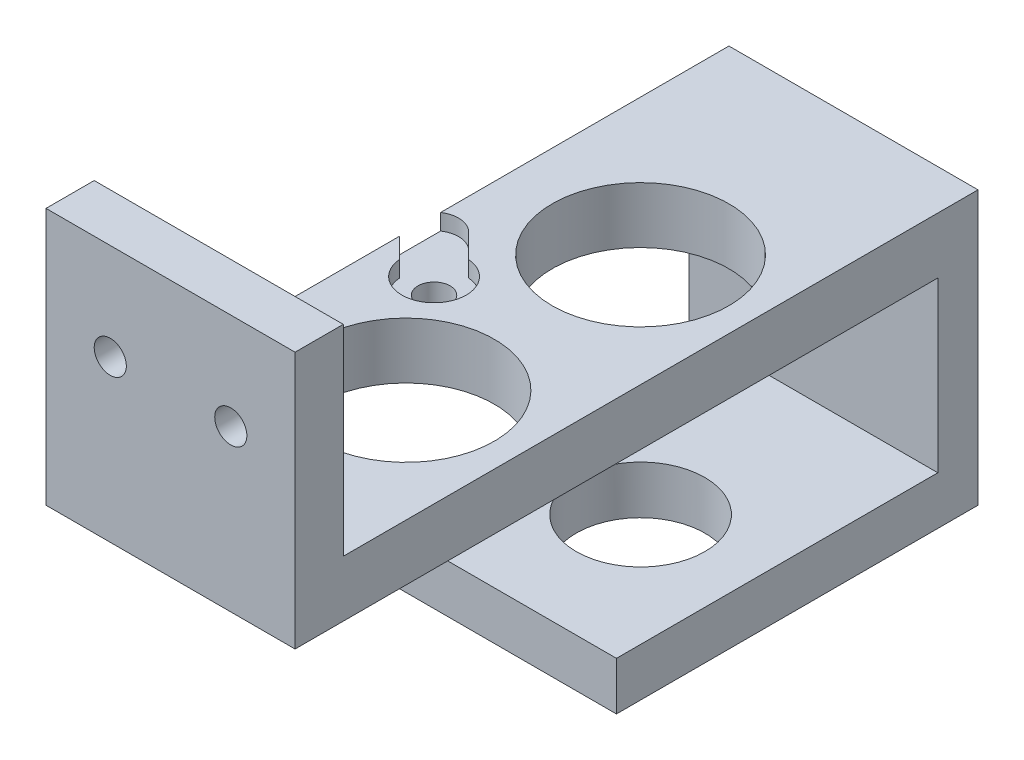
from build123d import *

# Parameters (mm, degrees)
SKETCH1_W           = 31
SKETCH1_H           = 85
BOSS_EXTRUDE1_DEPTH = 7
SKETCH2_R           = 11
CUT_EXTRUDE1_DEPTH  = 100
SKETCH3_R           = 11
CUT_EXTRUDE2_DEPTH  = 7
SKETCH4_W           = 31
SKETCH4_H           = 6
BOSS_EXTRUDE3_DEPTH = 25
SKETCH5_R           = 2
CUT_EXTRUDE3_DEPTH  = 14
SKETCH6_R           = 2
CUT_EXTRUDE4_DEPTH  = 14
SKETCH10_W          = 31
SKETCH10_H          = 5
BOSS_EXTRUDE4_DEPTH = 27
SKETCH11_W          = 31
SKETCH11_H          = 6
BOSS_EXTRUDE5_DEPTH = 40
SKETCH9_R           = 8
CUT_EXTRUDE5_DEPTH  = 40
SKETCH13_R          = 4
CUT_EXTRUDE6_DEPTH  = 2
CUT_EXTRUDE9_DEPTH  = 2


with BuildPart() as part:
    # Sketch1 → Boss-Extrude1 (new body)
    with BuildSketch(Plane(origin=(0, 0, 0), x_dir=(1, 0, 0), z_dir=(0, 1, 0))):
        with Locations((-34.66194332, -13.734817814)):
            Rectangle(SKETCH1_W, SKETCH1_H)
    extrude(amount=BOSS_EXTRUDE1_DEPTH)

    # Sketch2 → Cut-Extrude1 (cut)
    with BuildSketch(Plane(origin=(0, 7, 0), x_dir=(1, 0, 0), z_dir=(0, 1, 0))):
        with Locations((-33.16194332, 0.765182186)):
            Circle(SKETCH2_R)
    extrude(amount=-CUT_EXTRUDE1_DEPTH, mode=Mode.SUBTRACT)

    # Sketch3 → Cut-Extrude2 (cut)
    with BuildSketch(Plane(origin=(0, 7, 0), x_dir=(1, 0, 0), z_dir=(0, 1, 0))):
        with Locations((-33.16194332, -28.434817814)):
            Circle(SKETCH3_R)
    extrude(amount=-CUT_EXTRUDE2_DEPTH, mode=Mode.SUBTRACT)

    # Sketch4 → Boss-Extrude3 (add)
    with BuildSketch(Plane(origin=(0, 7, 0), x_dir=(1, 0, 0), z_dir=(0, 1, 0))):
        with Locations((-34.66194332, -53.234817814)):
            Rectangle(SKETCH4_W, SKETCH4_H)
    extrude(amount=BOSS_EXTRUDE3_DEPTH)

    # Sketch5 → Cut-Extrude3 (cut)
    with BuildSketch(Plane(origin=(0, 0, 50.234817814), x_dir=(-1, 0, 0), z_dir=(0, 0, -1))):
        with Locations((42.16194332, 20)):
            Circle(SKETCH5_R)
        with Locations((27.16194332, 20)):
            Circle(SKETCH5_R)
    extrude(amount=-CUT_EXTRUDE3_DEPTH, mode=Mode.SUBTRACT)

    # Sketch6 → Cut-Extrude4 (cut)
    with BuildSketch(Plane(origin=(0, 7, 0), x_dir=(1, 0, 0), z_dir=(0, 1, 0))):
        with Locations((-43.66194332, -14.434817814)):
            Circle(SKETCH6_R)
        with Locations((-43.66194332, -42.434817814)):
            Circle(SKETCH6_R)
    extrude(amount=-CUT_EXTRUDE4_DEPTH, mode=Mode.SUBTRACT)

    # Sketch10 → Boss-Extrude4 (add)
    with BuildSketch(Plane.XZ):
        with Locations((-34.66194332, -26.265182186)):
            Rectangle(SKETCH10_W, SKETCH10_H)
    extrude(amount=BOSS_EXTRUDE4_DEPTH)

    # Sketch11 → Boss-Extrude5 (add)
    with BuildSketch(Plane.XY.offset(-23.765182186)):
        with Locations((-34.66194332, -24)):
            Rectangle(SKETCH11_W, SKETCH11_H)
    extrude(amount=BOSS_EXTRUDE5_DEPTH)

    # Sketch9 → Cut-Extrude5 (cut)
    with BuildSketch(Plane(origin=(0, 7, 0), x_dir=(1, 0, 0), z_dir=(0, 1, 0))):
        with Locations((-33.16194332, 0.765182186)):
            Circle(SKETCH9_R)
    extrude(amount=-CUT_EXTRUDE5_DEPTH, mode=Mode.SUBTRACT)

    # Sketch13 → Cut-Extrude6 (cut)
    with BuildSketch(Plane(origin=(0, 7, 0), x_dir=(1, 0, 0), z_dir=(0, 1, 0))):
        with Locations((-43.66194332, -14.434817814)):
            Circle(SKETCH13_R)
        with Locations((-43.66194332, -42.434817814)):
            Circle(SKETCH13_R)
    extrude(amount=-CUT_EXTRUDE6_DEPTH, mode=Mode.SUBTRACT)

    # Sketch15 → Cut-Extrude9 (cut)
    with BuildSketch(Plane(origin=(0, 7, 0), x_dir=(1, 0, 0), z_dir=(0, 1, 0))):
        with BuildLine():
            Line((-45.819303215, -16.592177709), (-50.604875862, -11.806605062))
            ThreePointArc((-50.604875862, -11.806605062), (-50.604875862, -7.491885272), (-46.290156072, -7.491885272))
            Line((-46.290156072, -7.491885272), (-41.504583425, -12.277457919))
            ThreePointArc((-41.504583425, -12.277457919), (-41.504583425, -16.592177709), (-45.819303215, -16.592177709))
        make_face()
        with BuildLine():
            Line((-41.316782848, -44.779978286), (-46.538440027, -50.001635465))
            ThreePointArc((-46.538440027, -50.001635465), (-51.228760971, -50.001635465), (-51.228760971, -45.311314521))
            Line((-51.228760971, -45.311314521), (-46.007103792, -40.089657342))
            ThreePointArc((-46.007103792, -40.089657342), (-41.316782848, -40.089657342), (-41.316782848, -44.779978286))
        make_face()
    extrude(amount=-CUT_EXTRUDE9_DEPTH, mode=Mode.SUBTRACT)


solid = part.part
